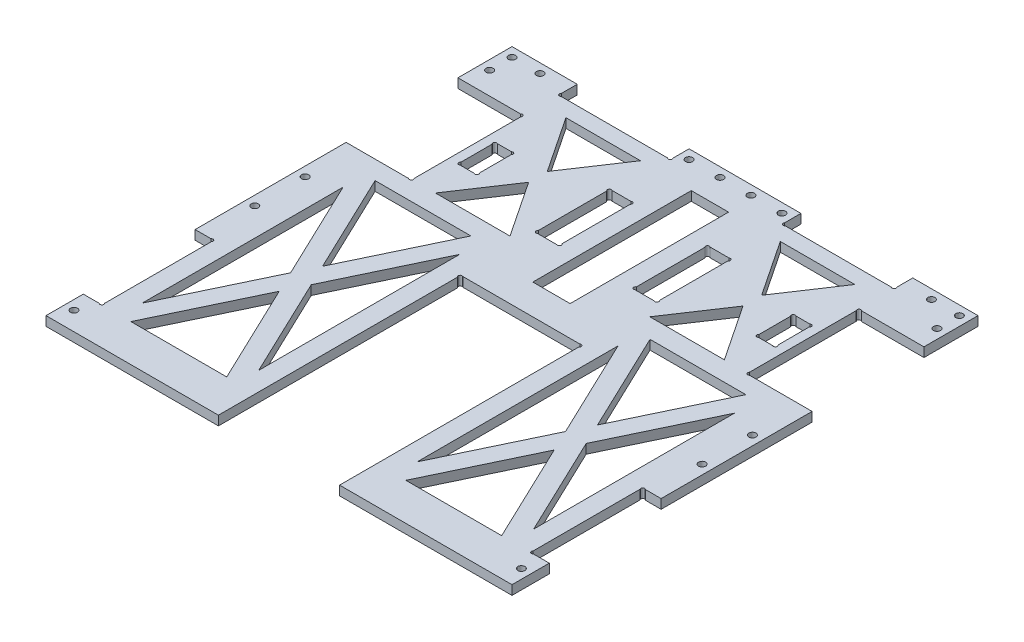
from build123d import *

# Parameters (mm, degrees)
BOSS_EXTRUDE1_DEPTH = 6.35
SKETCH2_W           = 44.45
SKETCH2_H           = 76.2
SKETCH2_W_2         = 12.7
SKETCH2_W_3         = 76.2
SKETCH2_H_2         = 12.7
CUT_EXTRUDE1_DEPTH  = 289.907554418
CUT_EXTRUDE3_DEPTH  = 289.907554418
SKETCH3_W           = 15.875
SKETCH3_H           = 50.8
SKETCH3_W_2         = 12.7
SKETCH3_H_2         = 25.4
CUT_EXTRUDE2_DEPTH  = 289.907554418
SKETCH7_R           = 2.413
CUT_EXTRUDE6_DEPTH  = 289.907554418
SKETCH10_R          = 1.27
CUT_EXTRUDE7_DEPTH  = 289.907554418
SKETCH12_W          = 25.4
SKETCH12_H          = 107.95
CUT_EXTRUDE9_DEPTH  = 289.907554418


with BuildPart() as part:
    # Sketch1 → Boss-Extrude1 (new body)
    with BuildSketch(Plane(origin=(0, 0, 0), x_dir=(1, 0, 0), z_dir=(0, 1, 0))):
        Polygon((-158.75, 76.2), (-158.75, -241.3), (-41.275, -241.3), (-41.275, -76.2), (41.275, -76.2), (41.275, -241.3), (158.75, -241.3), (158.75, 76.2), align=None)
    extrude(amount=BOSS_EXTRUDE1_DEPTH)

    # Sketch2 → Cut-Extrude1 (cut, through all)
    with BuildSketch(Plane(origin=(0, 6.35, 0), x_dir=(1, 0, 0), z_dir=(0, 1, 0))):
        with Locations((136.525, 1.27)):
            Rectangle(SKETCH2_W, SKETCH2_H)
        with Locations((152.4, -177.8)):
            Rectangle(SKETCH2_W_2, SKETCH2_H)
        with Locations((-152.4, -177.8)):
            Rectangle(SKETCH2_W_2, SKETCH2_H)
        with Locations((-136.525, 1.27)):
            Rectangle(SKETCH2_W, SKETCH2_H)
        with Locations((-76.2, 69.85)):
            Rectangle(SKETCH2_W_3, SKETCH2_H_2)
        with Locations((76.2, 69.85)):
            Rectangle(SKETCH2_W_3, SKETCH2_H_2)
    extrude(amount=-CUT_EXTRUDE1_DEPTH, mode=Mode.SUBTRACT)

    # Sketch4 → Cut-Extrude3 (cut, through all)
    with BuildSketch(Plane(origin=(0, 6.35, 0), x_dir=(1, 0, 0), z_dir=(0, 1, 0))):
        Polygon((93.6625, -147.46179464), (61.010684466, -215.9), (126.314315534, -215.9), align=None)
        Polygon((53.975, -64.27679464), (53.975, -201.15320536), (86.626815534, -132.715), align=None)
        Polygon((133.35, -64.27679464), (100.698184466, -132.715), (133.35, -201.15320536), align=None)
        Polygon((61.010684466, -49.53), (93.6625, -117.96820536), (126.314315534, -49.53), align=None)
        Polygon((-86.626815534, -132.715), (-53.975, -201.15320536), (-53.975, -64.27679464), align=None)
        Polygon((-126.314315534, -49.53), (-93.6625, -117.96820536), (-61.010684466, -49.53), align=None)
        Polygon((-61.010684466, -215.9), (-93.6625, -147.46179464), (-126.314315534, -215.9), align=None)
        Polygon((-133.35, -201.15320536), (-100.698184466, -132.715), (-133.35, -64.27679464), align=None)
    extrude(amount=-CUT_EXTRUDE3_DEPTH, mode=Mode.SUBTRACT)

    # Sketch3 → Cut-Extrude2 (cut, through all)
    with BuildSketch(Plane(origin=(0, 6.35, 0), x_dir=(1, 0, 0), z_dir=(0, 1, 0))):
        with Locations((-33.3375, 0)):
            Rectangle(SKETCH3_W, SKETCH3_H)
        with Locations((33.3375, 0)):
            Rectangle(SKETCH3_W, SKETCH3_H)
        with Locations((101.6, 1.27)):
            Rectangle(SKETCH3_W_2, SKETCH3_H_2)
        with Locations((-101.6, 1.27)):
            Rectangle(SKETCH3_W_2, SKETCH3_H_2)
    extrude(amount=-CUT_EXTRUDE2_DEPTH, mode=Mode.SUBTRACT)

    # Sketch7 → Cut-Extrude6 (cut, through all)
    with BuildSketch(Plane(origin=(0, 6.35, 0), x_dir=(1, 0, 0), z_dir=(0, 1, 0))):
        with Locations((152.4, -105.41)):
            Circle(SKETCH7_R)
        with Locations((152.4, -71.12)):
            Circle(SKETCH7_R)
        with Locations((152.4, -228.6)):
            Circle(SKETCH7_R)
        with Locations((152.4, 69.85)):
            Circle(SKETCH7_R)
        with Locations((133.35, 69.85)):
            Circle(SKETCH7_R)
        with Locations((152.4, 54.61)):
            Circle(SKETCH7_R)
        with Locations((-152.4, -228.6)):
            Circle(SKETCH7_R)
        with Locations((-31.75, 69.85)):
            Circle(SKETCH7_R)
        with Locations((-10.668, 69.85)):
            Circle(SKETCH7_R)
        with Locations((10.414, 69.85)):
            Circle(SKETCH7_R)
        with Locations((31.496, 69.85)):
            Circle(SKETCH7_R)
        with Locations((-152.4, 54.61)):
            Circle(SKETCH7_R)
        with Locations((-133.35, 69.85)):
            Circle(SKETCH7_R)
        with Locations((-152.4, 69.85)):
            Circle(SKETCH7_R)
        with Locations((-152.4, -71.12)):
            Circle(SKETCH7_R)
        with Locations((-152.4, -105.41)):
            Circle(SKETCH7_R)
    extrude(amount=-CUT_EXTRUDE6_DEPTH, mode=Mode.SUBTRACT)

    # Sketch10 → Cut-Extrude7 (cut, through all)
    with BuildSketch(Plane(origin=(0, 6.35, 0), x_dir=(1, 0, 0), z_dir=(0, 1, 0))):
        with Locations((-146.972777351, -215.027427963)):
            Circle(SKETCH10_R)
        with Locations((-147.028600744, -140.509469322)):
            Circle(SKETCH10_R)
        with Locations((-115.209517005, -35.943614747)):
            Circle(SKETCH10_R)
        with Locations((-115.253299238, 38.530881079)):
            Circle(SKETCH10_R)
        with Locations((-113.422071626, 64.417682826)):
            Circle(SKETCH10_R)
        with Locations((-39.079710289, 64.308126073)):
            Circle(SKETCH10_R)
        with Locations((-107.193508458, 12.949891895)):
            Circle(SKETCH10_R)
        with Locations((-96.092799657, 13.019953297)):
            Circle(SKETCH10_R)
        with Locations((-107.232715406, -10.381952858)):
            Circle(SKETCH10_R)
        with Locations((-96.02881134, -10.426828581)):
            Circle(SKETCH10_R)
        with Locations((-40.581129145, 24.336306794)):
            Circle(SKETCH10_R)
        with Locations((-26.218352303, 24.428815409)):
            Circle(SKETCH10_R)
        with Locations((-40.523647956, -24.376100539)):
            Circle(SKETCH10_R)
        with Locations((-25.995686631, -24.278368404)):
            Circle(SKETCH10_R)
        with Locations((-40.57220406, -77.257817502)):
            Circle(SKETCH10_R)
        with Locations((40.57220406, -77.257817502)):
            Circle(SKETCH10_R)
        with Locations((25.995686631, -24.278368404)):
            Circle(SKETCH10_R)
        with Locations((40.523647956, -24.376100539)):
            Circle(SKETCH10_R)
        with Locations((26.218352303, 24.428815409)):
            Circle(SKETCH10_R)
        with Locations((40.581129145, 24.336306794)):
            Circle(SKETCH10_R)
        with Locations((96.02881134, -10.426828581)):
            Circle(SKETCH10_R)
        with Locations((107.232715406, -10.381952858)):
            Circle(SKETCH10_R)
        with Locations((96.092799657, 13.019953297)):
            Circle(SKETCH10_R)
        with Locations((107.193508458, 12.949891895)):
            Circle(SKETCH10_R)
        with Locations((39.079710289, 64.308126073)):
            Circle(SKETCH10_R)
        with Locations((113.422071626, 64.417682826)):
            Circle(SKETCH10_R)
        with Locations((115.253299238, 38.530881079)):
            Circle(SKETCH10_R)
        with Locations((115.209517005, -35.943614747)):
            Circle(SKETCH10_R)
        with Locations((147.028600744, -140.509469322)):
            Circle(SKETCH10_R)
        with Locations((146.972777351, -215.027427963)):
            Circle(SKETCH10_R)
    extrude(amount=-CUT_EXTRUDE7_DEPTH, mode=Mode.SUBTRACT)

    # Sketch12 → Cut-Extrude9 (cut, through all)
    with BuildSketch(Plane(origin=(0, 6.35, 0), x_dir=(1, 0, 0), z_dir=(0, 1, 0))):
        Polygon((-98.425, 52.614228607), (-47.625, 52.614228607), (-73.025, 14.514228607), align=None)
        Polygon((-47.625, -36.285771393), (-73.025, 1.814228607), (-98.425, -36.285771393), align=None)
        Polygon((73.025, 1.814228607), (98.425, -36.285771393), (47.625, -36.285771393), align=None)
        Polygon((73.025, 14.514228607), (98.425, 52.614228607), (47.625, 52.614228607), align=None)
        with Locations((0, -1.679180184)):
            Rectangle(SKETCH12_W, SKETCH12_H)
    extrude(amount=-CUT_EXTRUDE9_DEPTH, mode=Mode.SUBTRACT)


solid = part.part
